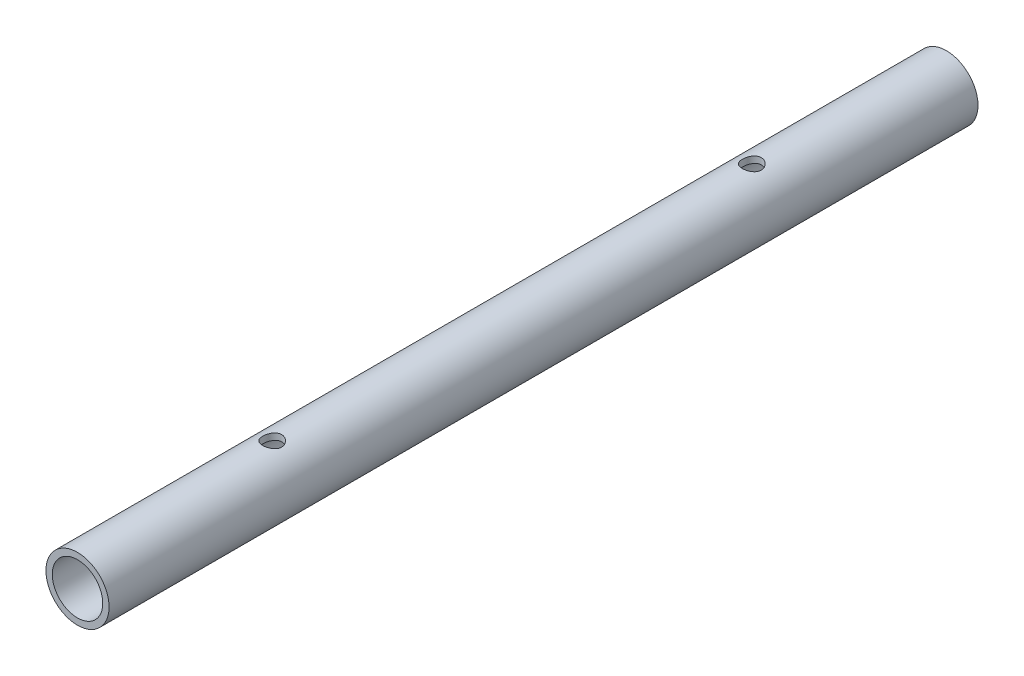
from build123d import *

# Parameters (mm, degrees)
SKETCH1_R               = 5
BOSS_EXTRUDE1_DEPTH     = 137.657
CUT_EXTRUDE1_REACH      = 139.838
SKETCH2_R               = 4
CUT_EXTRUDE2_DEPTH      = 138.838491174
CUT_EXTRUDE2_DEPTH_BACK = 138.838491174
SKETCH5_R               = 1.5


with BuildPart() as part:
    # Sketch1 → Boss-Extrude1 (new body)
    with BuildSketch(Plane.XY):
        Circle(SKETCH1_R)
    extrude(amount=BOSS_EXTRUDE1_DEPTH)

    # Sketch2 → Cut-Extrude1 (cut, up to next)
    with BuildSketch(Plane.XY.offset(137.657), mode=Mode.PRIVATE) as cut_extrude1_sk1:
        Circle(SKETCH2_R)
    cut_extrude1_tool1 = extrude(cut_extrude1_sk1.sketch, amount=-CUT_EXTRUDE1_REACH, mode=Mode.PRIVATE) & part.part
    add(cut_extrude1_tool1.solids().sort_by_distance((0, 0, 137.657))[0], mode=Mode.SUBTRACT)

    # Sketch5 → Cut-Extrude2 (cut, two sides: drawn at the far end of the back side and taken through both)
    with BuildSketch(Plane(origin=(0, 0, 0), x_dir=(1, 0, 0), z_dir=(0, 1, 0)).offset(-CUT_EXTRUDE2_DEPTH_BACK)):
        with Locations((0, -30.835)):
            Circle(SKETCH5_R)
        with Locations((0, -106.822)):
            Circle(SKETCH5_R)
    extrude(amount=CUT_EXTRUDE2_DEPTH + CUT_EXTRUDE2_DEPTH_BACK, mode=Mode.SUBTRACT)


solid = part.part
